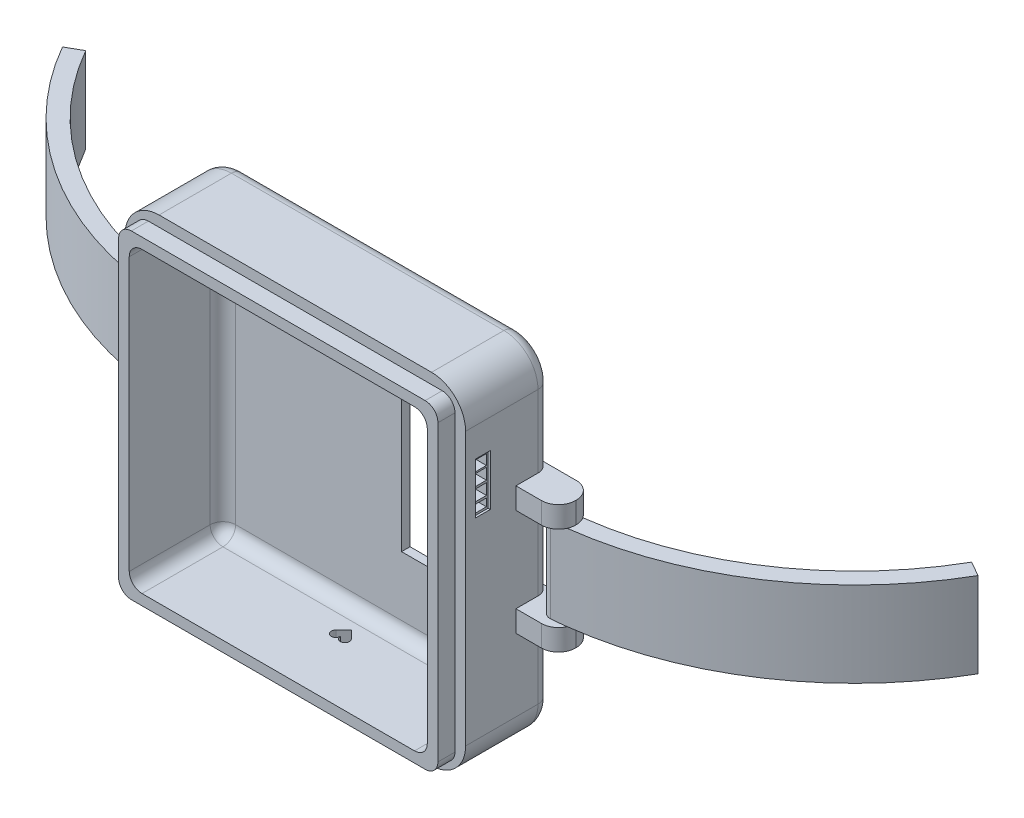
from build123d import *

# Parameters (mm, degrees)
ESQUISSE1_W              = 80
ESQUISSE1_H              = 80
BOSS_EXTRU_1_DEPTH       = 20
CONG_1_R                 = 8
ESQUISSE2_W              = 70
ESQUISSE2_H              = 70
ENL_V_MAT_EXTRU_1_DEPTH  = 18
ESQUISSE3_W              = 24.948878454
ESQUISSE3_H              = 36
ENL_V_MAT_EXTRU_2_DEPTH  = 60.363288319
ESQUISSE4_W              = 75
ESQUISSE4_H              = 75
ESQUISSE4_W_2            = 70
ESQUISSE4_H_2            = 70
BOSS_EXTRU_2_DEPTH       = 4
ESQUISSE5_W              = 8.18
ESQUISSE5_H              = 30
BOSS_EXTRU_3_DEPTH       = 10
ESQUISSE6_W              = 8.18
ESQUISSE6_H              = 20
ENL_V_MAT_EXTRU_4_DEPTH  = 10
CONG_3_R                 = 4
BOSS_EXTRU_4_REACH       = 76.673
ESQUISSE7_R              = 2
CONG_3_OF_SYM_TRIE1_R    = 4
CONG_4_R                 = 3
CONG_5_R                 = 3
CONG_6_R                 = 3
CONG_7_R                 = 3
ENL_V_MAT_EXTRU_8_DEPTH  = 5
ESQUISSE14_W             = 7
ESQUISSE14_H             = 10
BOSS_EXTRU_7_DEPTH       = 5
CONG_10_R                = 2
ESQUISSE16_W             = 5.074992096
ESQUISSE16_H             = 7.740388462
ENL_V_MAT_EXTRU_9_DEPTH  = 4.5
CONG_11_R                = 1
ESQUISSE17_W             = 3.086107541
ESQUISSE17_H             = 7.740388462
BOSS_EXTRU_8_DEPTH       = 4
ESQUISSE19_W             = 3.365442466
ESQUISSE19_H             = 1
BOSS_EXTRU_9_DEPTH       = 1
CHANFREIN2_SIZE          = 0.5
BOSS_EXTRU_10_START      = 20
BOSS_EXTRU_10_DEPTH      = 20
ESQUISSE21_W             = 7.5
ESQUISSE21_H             = 6.5
ENL_V_MAT_EXTRU_10_DEPTH = 4.5
CHANFREIN3_SIZE          = 2
ESQUISSE22_W             = 3.5
ESQUISSE22_H             = 2.172125707
BOSS_EXTRU_11_DEPTH      = 5
ESQUISSE23_W             = 0.953624335
ESQUISSE23_H             = 4.294487081
ESQUISSE23_W_2           = 0.889491447
BOSS_EXTRU_12_DEPTH      = 0.6
CHANFREIN4_SIZE          = 2
ESQUISSE24_R             = 1.5
ENL_V_MAT_EXTRU_11_DEPTH = 4
ESQUISSE25_W             = 3.471840611
ESQUISSE25_H             = 11.977850108
ENL_V_MAT_EXTRU_12_DEPTH = 5
ESQUISSE26_W             = 3.471840611
ESQUISSE26_H             = 11.967764894
ESQUISSE26_W_2           = 2.57397563
ESQUISSE26_H_2           = 2.413895723
ESQUISSE26_H_3           = 2.629859333
ESQUISSE26_H_4           = 2.607444001
ESQUISSE26_H_5           = 1.799516468
BOSS_EXTRU_13_DEPTH      = 3.5


with BuildPart() as part:
    # Esquisse1 → Boss.-Extru.1 (new body)
    with BuildSketch(Plane.XY):
        Rectangle(ESQUISSE1_W, ESQUISSE1_H)
    extrude(amount=BOSS_EXTRU_1_DEPTH)

    # Congé1
    cong_1_edges = [part.edges().sort_by_distance(p)[0] for p in [
        (40, -40, 10),
        (-40, -40, 10),
        (-40, 40, 10),
        (40, 40, 10),
    ]]
    fillet(cong_1_edges, radius=CONG_1_R)

    # Esquisse2 → Enlèv. mat.-Extru.1 (cut)
    with BuildSketch(Plane.XY.offset(20)):
        Rectangle(ESQUISSE2_W, ESQUISSE2_H)
    extrude(amount=-ENL_V_MAT_EXTRU_1_DEPTH, mode=Mode.SUBTRACT)

    # Esquisse3 → Enlèv. mat.-Extru.2 (cut, through all)
    with BuildSketch(Plane.XY.offset(2)):
        with Locations((19.435637568, 0)):
            Rectangle(ESQUISSE3_W, ESQUISSE3_H)
    extrude(amount=-ENL_V_MAT_EXTRU_2_DEPTH, mode=Mode.SUBTRACT)

    # Esquisse4 → Boss.-Extru.2 (add)
    with BuildSketch(Plane.XY.offset(20)):
        Rectangle(ESQUISSE4_W, ESQUISSE4_H)
        Rectangle(ESQUISSE4_W_2, ESQUISSE4_H_2, mode=Mode.SUBTRACT)
    extrude(amount=BOSS_EXTRU_2_DEPTH)

    # Esquisse5 → Boss.-Extru.3 (add)
    with BuildSketch(Plane(origin=(40, 0, 0), x_dir=(0, 0, -1), z_dir=(1, 0, 0))):
        with Locations((-4.09, 0)):
            Rectangle(ESQUISSE5_W, ESQUISSE5_H)
    boss_extru_3 = extrude(amount=BOSS_EXTRU_3_DEPTH)

    # Esquisse6 → Enlèv. mat.-Extru.4 (cut)
    with BuildSketch(Plane(origin=(50, 0, 0), x_dir=(0, 0, -1), z_dir=(1, 0, 0))):
        with Locations((-4.09, 0)):
            Rectangle(ESQUISSE6_W, ESQUISSE6_H)
    enl_v_mat_extru_4 = extrude(amount=-ENL_V_MAT_EXTRU_4_DEPTH, mode=Mode.SUBTRACT)

    # Congé3
    cong_3_edges = [part.edges().sort_by_distance(p)[0] for p in [
        (50, 12.5, 0),
        (50, -12.5, 8.18),
        (50, -12.5, 0),
        (50, 12.5, 8.18),
    ]]
    fillet(cong_3_edges, radius=CONG_3_R)

    # Esquisse7 → Boss.-Extru.4 (add, up to next)
    with BuildSketch(Plane(origin=(0, 10, 0), x_dir=(-1, 0, 0), z_dir=(0, -1, 0)), mode=Mode.PRIVATE) as boss_extru_4_sk1:
        with Locations(Location((-46, -4.18, 0), (0, 0, 270))):
            Circle(ESQUISSE7_R)
    boss_extru_4_tool1 = extrude(boss_extru_4_sk1.sketch, amount=BOSS_EXTRU_4_REACH, mode=Mode.PRIVATE) - part.part
    boss_extru_4 = boss_extru_4_tool1.solids().sort_by_distance((46, 10, 4.18))[0]
    add(boss_extru_4)

    # Symétrie1: Boss.-Extru.3, Enlèv. mat.-Extru.4, Boss.-Extru.4 across plane
    add(boss_extru_3.mirror(Plane(origin=(0, 0, 0), x_dir=(0, 0, 1), z_dir=(1, 0, 0))))
    add(enl_v_mat_extru_4.mirror(Plane(origin=(0, 0, 0), x_dir=(0, 0, 1), z_dir=(1, 0, 0))), mode=Mode.SUBTRACT)
    add(boss_extru_4.mirror(Plane(origin=(0, 0, 0), x_dir=(0, 0, 1), z_dir=(1, 0, 0))))

    # Congé3 of Symétrie1
    cong_3_of_sym_trie1_edges = [part.edges().sort_by_distance(p)[0] for p in [
        (-50, 12.5, 0),
        (-50, -12.5, 8.18),
        (-50, -12.5, 0),
        (-50, 12.5, 8.18),
    ]]
    fillet(cong_3_of_sym_trie1_edges, radius=CONG_3_OF_SYM_TRIE1_R)

    # Congé4
    cong_4_edges = [part.edges().sort_by_distance(p)[0] for p in [
        (37.5, -37.5, 22),
        (37.5, 37.5, 22),
        (-37.5, 37.5, 22),
        (-37.5, -37.5, 22),
    ]]
    fillet(cong_4_edges, radius=CONG_4_R)

    # Congé5
    cong_5_edges = [part.edges().sort_by_distance(p)[0] for p in [
        (35, 35, 13),
        (35, -35, 13),
        (-35, -35, 13),
        (-35, 35, 13),
    ]]
    fillet(cong_5_edges, radius=CONG_5_R)

    # Congé6
    cong_6_edges = [part.edges().sort_by_distance(p)[0] for p in [
        (35, 0, 2),
        (0, -35, 2),
        (0, 35, 2),
        (-35, 0, 2),
        (-34.121320344, -34.121320344, 2),
        (-34.121320344, 34.121320344, 2),
        (34.121320344, 34.121320344, 2),
        (34.121320344, -34.121320344, 2),
    ]]
    fillet(cong_6_edges, radius=CONG_6_R)

    # Congé7
    cong_7_edges = [part.edges().sort_by_distance(p)[0] for p in [
        (40, 0, 0),
        (40, -23.5, 0),
        (-40, -23.5, 0),
        (0, -40, 0),
        (-40, 23.5, 0),
        (0, 40, 0),
        (-40, 0, 0),
        (37.656854249, 37.656854249, 0),
        (-37.656854249, 37.656854249, 0),
        (-37.656854249, -37.656854249, 0),
        (37.656854249, -37.656854249, 0),
        (40, 23.5, 0),
    ]]
    fillet(cong_7_edges, radius=CONG_7_R)

    # Esquisse13 → Enlèv. mat.-Extru.8 (cut)
    with BuildSketch(Plane(origin=(0, -40, 0), x_dir=(-1, 0, 0), z_dir=(0, -1, 0))):
        with BuildLine():
            Line((1.819280953, -8.667936085), (0, -6.848655132))
            Line((0, -6.848655132), (-1.819280953, -8.667936085))
            ThreePointArc((-1.819280953, -8.667936085), (-1.473539711, -10.406094686), (0, -9.421506929))
            ThreePointArc((0, -9.421506929), (1.473539711, -10.406094686), (1.819280953, -8.667936085))
        make_face()
    extrude(amount=-ENL_V_MAT_EXTRU_8_DEPTH, mode=Mode.SUBTRACT)

    # Esquisse14 → Boss.-Extru.7 (add)
    with BuildSketch(Plane.ZY.offset(40)):
        with Locations((12.64033166, -24.41360617)):
            Rectangle(ESQUISSE14_W, ESQUISSE14_H)
    extrude(amount=BOSS_EXTRU_7_DEPTH)

    # Congé10
    cong_10_edges = [part.edges().sort_by_distance(p)[0] for p in [
        (-42.5, -29.41360617, 16.14033166),
        (-42.5, -19.41360617, 16.14033166),
        (-42.5, -19.41360617, 9.14033166),
        (-42.5, -29.41360617, 9.14033166),
    ]]
    fillet(cong_10_edges, radius=CONG_10_R)

    # Esquisse16 → Enlèv. mat.-Extru.9 (cut)
    with BuildSketch(Plane.ZY.offset(45)):
        with Locations((12.64033166, -24.41360617)):
            Rectangle(ESQUISSE16_W, ESQUISSE16_H)
    extrude(amount=-ENL_V_MAT_EXTRU_9_DEPTH, mode=Mode.SUBTRACT)

    # Congé11
    cong_11_edges = [part.edges().sort_by_distance(p)[0] for p in [
        (-42.75, -28.283800401, 10.102835612),
        (-42.75, -20.543411939, 10.102835612),
        (-42.75, -20.543411939, 15.177827708),
        (-42.75, -28.283800401, 15.177827708),
    ]]
    fillet(cong_11_edges, radius=CONG_11_R)

    # Esquisse17 → Boss.-Extru.8 (add)
    with BuildSketch(Plane.ZY.offset(40.5)):
        with Locations((11.09727789, -24.41360617)):
            Rectangle(ESQUISSE17_W, ESQUISSE17_H)
    extrude(amount=BOSS_EXTRU_8_DEPTH)

    # Esquisse19 → Boss.-Extru.9 (add)
    with BuildSketch(Plane.XY.offset(12.64033166)):
        with Locations((-42.182721233, -24.309742215)):
            Rectangle(ESQUISSE19_W, ESQUISSE19_H)
        with Locations((-42.182721233, -22.266461868)):
            Rectangle(ESQUISSE19_W, ESQUISSE19_H)
        with Locations((-42.182721233, -28.396302908)):
            Rectangle(ESQUISSE19_W, ESQUISSE19_H)
        with Locations((-42.182721233, -26.353022562)):
            Rectangle(ESQUISSE19_W, ESQUISSE19_H)
        with Locations((-42.182721233, -20.223181522)):
            Rectangle(ESQUISSE19_W, ESQUISSE19_H)
    extrude(amount=BOSS_EXTRU_9_DEPTH)

    # Chanfrein2
    chanfrein2_edges = [part.edges().sort_by_distance(p)[0] for p in [
        (-43.865442466, -24.309742215, 13.64033166),
        (-43.865442466, -26.353022562, 13.64033166),
        (-43.865442466, -28.090051655, 13.64033166),
        (-43.865442466, -22.266461868, 13.64033166),
        (-43.865442466, -20.63329673, 13.64033166),
    ]]
    chamfer(chanfrein2_edges, length=CHANFREIN2_SIZE)

    # Esquisse20 → Boss.-Extru.10 (add)
    with BuildSketch(Plane(origin=(0, -10, 0), x_dir=(1, 0, 0), z_dir=(0, 1, 0)).offset(BOSS_EXTRU_10_START)):
        with BuildLine():
            Line((104.038317736, 34.820120179), (107.510462599, 32.834116643))
            ThreePointArc((107.510462599, 32.834116643), (81.659931713, 5.74468593), (46.16278694, -6.173364094))
            ThreePointArc((46.16278694, -6.173364094), (44.006635906, -4.34278694), (45.83721306, -2.186635906))
            ThreePointArc((45.83721306, -2.186635906), (79.5136811, 9.120127872), (104.038317736, 34.820120179))
        make_face()
    boss_extru_10 = extrude(amount=-BOSS_EXTRU_10_DEPTH)

    # Symétrie2: Boss.-Extru.10 across plane
    add(boss_extru_10.mirror(Plane(origin=(0, 0, 0), x_dir=(0, 0, 1), z_dir=(1, 0, 0))))

    # Esquisse21 → Enlèv. mat.-Extru.10 (cut)
    with BuildSketch(Plane(origin=(0, -40, 0), x_dir=(-1, 0, 0), z_dir=(0, -1, 0))):
        with Locations((10.394530175, -9.5)):
            Rectangle(ESQUISSE21_W, ESQUISSE21_H)
    extrude(amount=-ENL_V_MAT_EXTRU_10_DEPTH, mode=Mode.SUBTRACT)

    # Chanfrein3
    chanfrein3_edges = [part.edges().sort_by_distance(p)[0] for p in [
        (-6.644530175, -37.75, 12.75),
        (-14.144530175, -37.75, 12.75),
    ]]
    chamfer(chanfrein3_edges, length=CHANFREIN3_SIZE)

    # Esquisse22 → Boss.-Extru.11 (add)
    with BuildSketch(Plane(origin=(0, -35.5, 0), x_dir=(-1, 0, 0), z_dir=(0, -1, 0))):
        with Locations((10.394530175, -9.074938395)):
            Rectangle(ESQUISSE22_W, ESQUISSE22_H)
    extrude(amount=BOSS_EXTRU_11_DEPTH)

    # Esquisse23 → Boss.-Extru.12 (add)
    with BuildSketch(Plane.XY.offset(10.161001248)):
        with Locations((-11.009760814, -37.725390229)):
            Rectangle(ESQUISSE23_W, ESQUISSE23_H)
        with Locations((-9.649847544, -37.725390229)):
            Rectangle(ESQUISSE23_W_2, ESQUISSE23_H)
    extrude(amount=BOSS_EXTRU_12_DEPTH)

    # Chanfrein4
    # the kernel refuses this chamfer: 2 mm, written as the material it takes off along each edge
    with BuildSketch(Plane(origin=(-9.20510182, -39.872633769, 10.761001248), x_dir=(0, -0.027495876610585623, -0.9996219169112968), z_dir=(-1, 0, 0))) as chanfrein4_piece_1_section:
        Polygon((CHANFREIN4_SIZE * 0.999621916911, -CHANFREIN4_SIZE * 0.0274958766106), (-CHANFREIN4_SIZE * 0.0274958766106, -CHANFREIN4_SIZE * 0.999621916911), (0, 0), align=None)
    chanfrein4_piece_1 = extrude(amount=6.032857422, mode=Mode.PRIVATE)
    chanfrein4_piece_1 = split(chanfrein4_piece_1, bisect_by=Plane(origin=(-9.649847543, -39.013810239, 10.161001248), z_dir=(0, 0, 1)), keep=Keep.TOP, mode=Mode.PRIVATE)
    chanfrein4_piece_1 = split(chanfrein4_piece_1, bisect_by=Plane(origin=(-11.486572981, -39.013810239, 10.478648307), z_dir=(1, 0, 0)), keep=Keep.TOP, mode=Mode.PRIVATE)
    add(chanfrein4_piece_1, mode=Mode.SUBTRACT)
    with BuildSketch(Plane(origin=(-5.38958267, -39.872633769, 10.761001248), x_dir=(0, -0.027495876610585623, -0.9996219169112968), z_dir=(-1, 0, 0))) as chanfrein4_piece_2_section:
        Polygon((CHANFREIN4_SIZE * 0.999621916911, -CHANFREIN4_SIZE * 0.0274958766106), (-CHANFREIN4_SIZE * 0.0274958766106, -CHANFREIN4_SIZE * 0.999621916911), (0, 0), align=None)
    chanfrein4_piece_2 = extrude(amount=6.096990311, mode=Mode.PRIVATE)
    chanfrein4_piece_2 = split(chanfrein4_piece_2, bisect_by=Plane(origin=(-9.649847543, -39.013810239, 10.161001248), z_dir=(0, 0, 1)), keep=Keep.TOP, mode=Mode.PRIVATE)
    chanfrein4_piece_2 = split(chanfrein4_piece_2, bisect_by=Plane(origin=(-9.20510182, -39.013810239, 10.478648307), z_dir=(-1, 0, 0)), keep=Keep.TOP, mode=Mode.PRIVATE)
    add(chanfrein4_piece_2, mode=Mode.SUBTRACT)

    # Esquisse24 → Enlèv. mat.-Extru.11 (cut)
    with BuildSketch(Plane(origin=(0, -40, 0), x_dir=(-1, 0, 0), z_dir=(0, -1, 0))):
        with Locations(Location((-20.877086375, -10.028537188, 0), (0, 0, 90))):
            Circle(ESQUISSE24_R)
    extrude(amount=-ENL_V_MAT_EXTRU_11_DEPTH, mode=Mode.SUBTRACT)

    # Esquisse25 → Enlèv. mat.-Extru.12 (cut)
    with BuildSketch(Plane(origin=(40, 0, 0), x_dir=(0, 0, -1), z_dir=(1, 0, 0))):
        with Locations((-15.941759668, 19.192307421)):
            Rectangle(ESQUISSE25_W, ESQUISSE25_H)
    extrude(amount=-ENL_V_MAT_EXTRU_12_DEPTH, mode=Mode.SUBTRACT)

    # Esquisse26 → Boss.-Extru.13 (add)
    with BuildSketch(Plane(origin=(36, 0, 0), x_dir=(0, 0, -1), z_dir=(1, 0, 0))):
        with Locations((-15.941759668, 19.197350028)):
            Rectangle(ESQUISSE26_W, ESQUISSE26_H)
        with Locations((-15.892493996, 23.309744794)):
            Rectangle(ESQUISSE26_W_2, ESQUISSE26_H_2, mode=Mode.SUBTRACT)
        with Locations((-15.892493996, 20.424172551)):
            Rectangle(ESQUISSE26_W_2, ESQUISSE26_H_3, mode=Mode.SUBTRACT)
        with Locations((-15.892493996, 17.313105159)):
            Rectangle(ESQUISSE26_W_2, ESQUISSE26_H_4, mode=Mode.SUBTRACT)
        with Locations((-15.892493996, 14.60155135)):
            Rectangle(ESQUISSE26_W_2, ESQUISSE26_H_5, mode=Mode.SUBTRACT)
    extrude(amount=BOSS_EXTRU_13_DEPTH)


solid = part.part
